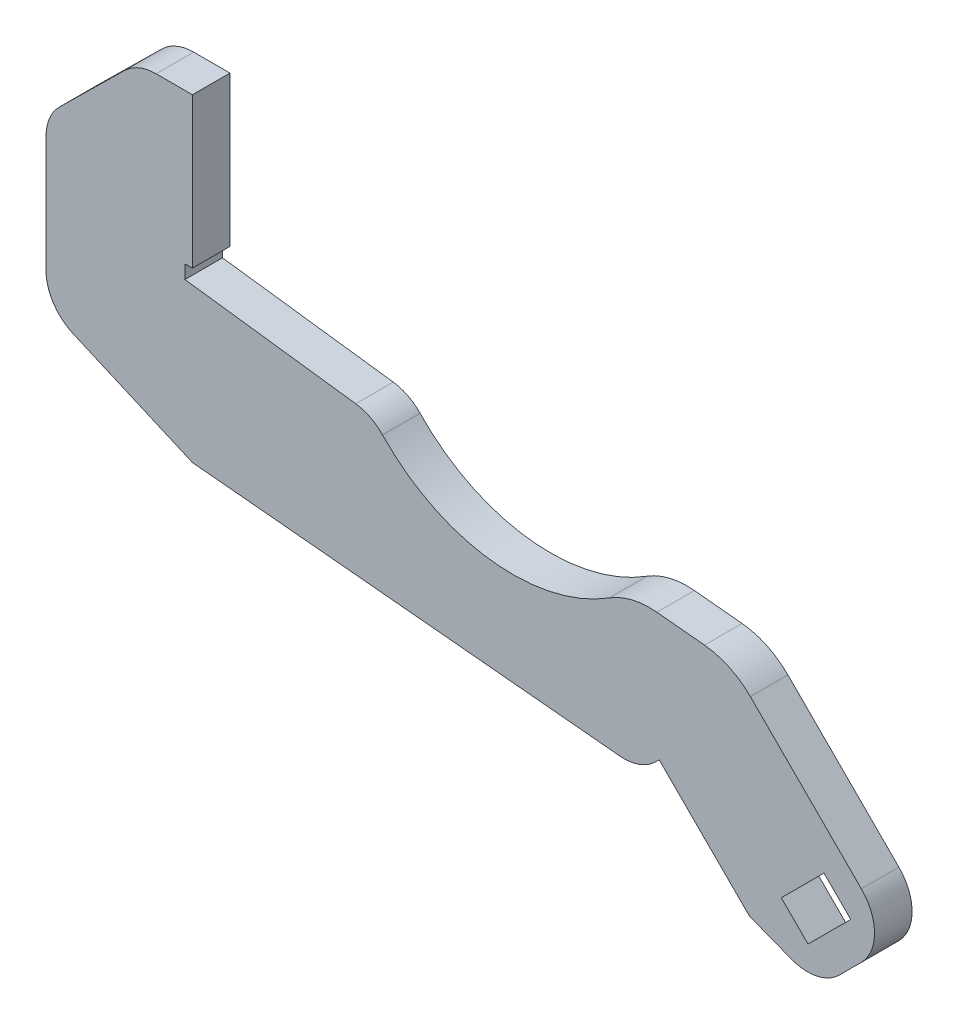
from build123d import *

# Parameters (mm, degrees)
BOSS_EXTRUDE1_DEPTH = 0.125
FILLET1_R           = 0.3
FILLET2_R           = 0.5


with BuildPart() as part:
    # frame_outline → Boss-Extrude1 (new, symmetric)
    with BuildSketch(Plane.XY):
        with BuildLine():
            Line((-0.05, -0.6), (-0.05, -1.6))
            Line((-0.05, -1.6), (-0.1, -1.6))
            Line((-0.1, -1.6), (-0.1, -1.690631342))
            Line((-0.1, -1.690631342), (1.149530794, -1.853054692))
            ThreePointArc((1.149530794, -1.853054692), (1.967232196, -2.294374324), (2.854868829, -2.019602037))
            Line((2.854868829, -2.019602037), (3.538793019, -2.08639569))
            Line((3.538793019, -2.08639569), (4.616700174, -3.164302846))
            Line((4.616700174, -3.164302846), (4.120311214, -3.660691806))
            Line((4.120311214, -3.660691806), (3.659277593, -3.482500897))
            Line((3.659277593, -3.482500897), (3.058236829, -2.881460133))
            Line((3.058236829, -2.881460133), (2.935621241, -3.004075721))
            Line((2.935621241, -3.004075721), (-0.05, -2.721174788))
            Line((-0.05, -2.721174788), (-1.025048244, -2.297249495))
            Line((-1.025048244, -2.297249495), (-1.025048244, -1.201582707))
            Line((-1.025048244, -1.201582707), (-0.414440871, -0.6))
            Line((-0.414440871, -0.6), (-0.05, -0.6))
        make_face()
        Polygon((3.871409627, -3.270368863), (4.049600536, -3.448559772), (4.333857462, -3.164302846), (4.155666553, -2.986111937), align=None, mode=Mode.SUBTRACT)
    extrude(amount=BOSS_EXTRUDE1_DEPTH, both=True)

    # Fillet1
    fillet1_edges = [part.edges().sort_by_distance(p)[0] for p in [
        (4.616700174, -3.164302846, 0),
        (4.120311214, -3.660691806, 0),
        (1.149530794, -1.853054692, 0),
        (-0.414440871, -0.6, 0),
        (-1.025048244, -1.201582707, 0),
        (-1.025048244, -2.297249495, 0),
        (2.935621241, -3.004075721, 0),
    ]]
    fillet(fillet1_edges, radius=FILLET1_R)

    # Fillet2
    fillet2_edges = [part.edges().sort_by_distance(p)[0] for p in [
        (3.538793019, -2.08639569, 0),
        (2.854868829, -2.019602037, 0),
    ]]
    fillet(fillet2_edges, radius=FILLET2_R)


solid = part.part
